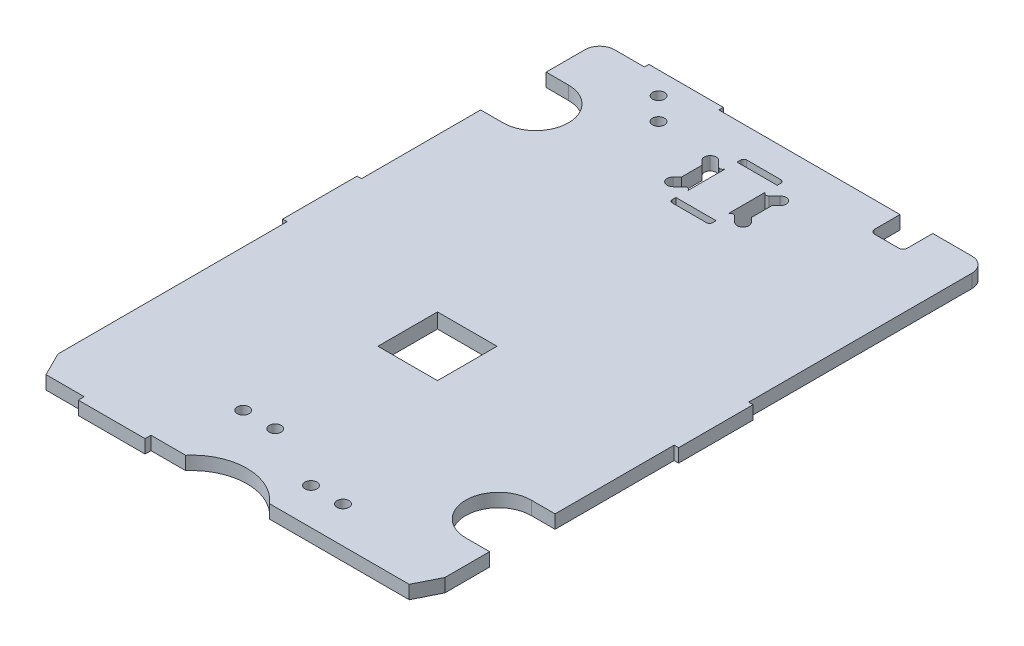
from build123d import *

# Parameters (mm, degrees)
CROQUIS1_R               = 0.4
SALIENTE_EXTRUIR1_DEPTH  = 0.9
SALIENTE_EXTRUIR2_DEPTH  = 0.1
CROQUIS9_W               = 4
CROQUIS9_H               = 4
CORTAR_EXTRUIR1_DEPTH    = 24.083103769
CROQUIS11_W              = 1.7
CROQUIS11_H              = 2.1
CROQUIS11_W_2            = 4.63
CROQUIS11_H_2            = 3.2
CROQUIS11_W_3            = 0.8
CROQUIS11_H_3            = 1.6
CROQUIS11_W_4            = 3
CROQUIS11_H_4            = 2.7
CROQUIS11_W_5            = 0.5
CROQUIS11_H_5            = 1
CROQUIS11_W_6            = 1
CROQUIS11_H_6            = 0.5
CROQUIS11_W_7            = 2.1
CROQUIS11_H_7            = 1.2
CROQUIS11_W_8            = 2.7
CROQUIS11_H_8            = 4.11
CROQUIS11_W_9            = 1.608844284
SALIENTE_EXTRUIR3_DEPTH  = 0.5
CROQUIS12_R              = 1.6
SALIENTE_EXTRUIR5_DEPTH  = 1.5
CROQUIS13_W              = 3.618464466
CROQUIS13_H              = 3.2
SALIENTE_EXTRUIR6_DEPTH  = 0.5
CROQUIS15_W              = 3
CROQUIS15_H              = 2.7
SALIENTE_EXTRUIR7_DEPTH  = 0.4
CROQUIS16_W              = 2.7
CROQUIS16_H              = 4.11
SALIENTE_EXTRUIR8_DEPTH  = 2
REDONDEO1_R              = 1.5
CORTAR_EXTRUIR3_DEPTH    = 4.11
CROQUIS21_W              = 2.7
CROQUIS21_H              = 4.11
SALIENTE_EXTRUIR10_DEPTH = 0.9
CROQUIS22_W              = 0.3
CROQUIS22_H              = 5
CROQUIS22_W_2            = 4.485919578
CROQUIS22_H_2            = 0.396504541
CROQUIS22_W_3            = 5
CROQUIS22_H_3            = 0.3
SALIENTE_EXTRUIR11_DEPTH = 0.9


with BuildPart() as part:
    # Croquis1 → Saliente-Extruir1 (new body)
    with BuildSketch(Plane(origin=(0, 0, 0), x_dir=(1, 0, 0), z_dir=(0, 1, 0))):
        with BuildLine():
            Line((-12.945636725, 11.010872655), (-11.445636725, 11.010872655))
            ThreePointArc((-11.445636725, 11.010872655), (-9.890001807, 11.655237736), (-9.245636725, 13.210872655))
            ThreePointArc((-9.245636725, 13.210872655), (-9.890001807, 14.766507574), (-11.445636725, 15.410872655))
            Line((-11.445636725, 15.410872655), (-12.945636725, 15.410872655))
            Line((-12.945636725, 15.410872655), (-12.945636725, 18.010872655))
            ThreePointArc((-12.945636725, 18.010872655), (-12.652743507, 18.717979436), (-11.945636725, 19.010872655))
            Line((-11.945636725, 19.010872655), (-9.945636725, 19.010872655))
            Line((-9.945636725, 19.010872655), (7.229363275, 19.010872655))
            Line((7.229363275, 19.010872655), (7.229363275, 17.310872655))
            ThreePointArc((7.229363275, 17.310872655), (7.31723124, 17.098740621), (7.529363275, 17.010872655))
            Line((7.529363275, 17.010872655), (9.129363275, 17.010872655))
            ThreePointArc((9.129363275, 17.010872655), (9.341495309, 17.098740621), (9.429363275, 17.310872655))
            Line((9.429363275, 17.310872655), (9.429363275, 19.010872655))
            Line((9.429363275, 19.010872655), (12.054363275, 19.010872655))
            ThreePointArc((12.054363275, 19.010872655), (12.761470056, 18.717979436), (13.054363275, 18.010872655))
            Line((13.054363275, 18.010872655), (13.054363275, -9.989127345))
            Line((13.054363275, -9.989127345), (11.454363275, -9.989127345))
            ThreePointArc((11.454363275, -9.989127345), (9.898728356, -10.633492426), (9.254363275, -12.189127345))
            ThreePointArc((9.254363275, -12.189127345), (9.898728356, -13.744762264), (11.454363275, -14.389127345))
            Line((11.454363275, -14.389127345), (13.054363275, -14.389127345))
            Line((13.054363275, -14.389127345), (13.054363275, -17.389127345))
            Line((13.054363275, -17.389127345), (12.254363275, -18.989127345))
            Line((12.254363275, -18.989127345), (2.870363275, -18.989127345))
            ThreePointArc((2.870363275, -18.989127345), (0.054363275, -17.689112497), (-2.761636725, -18.989127345))
            Line((-2.761636725, -18.989127345), (-12.145636725, -18.989127345))
            Line((-12.145636725, -18.989127345), (-12.945636725, -17.389127345))
            Line((-12.945636725, -17.389127345), (-12.945636725, 11.010872655))
        make_face()
        with Locations(Location((-6.295636725, 16.310872655, 0), (0, 0, 270))):
            Circle(CROQUIS1_R, mode=Mode.SUBTRACT)
        with Locations(Location((-7.795636725, 17.810872655, 0), (0, 0, 270))):
            Circle(CROQUIS1_R, mode=Mode.SUBTRACT)
        with Locations(Location((5.354363275, -16.539127345, 0), (0, 0, 270))):
            Circle(CROQUIS1_R, mode=Mode.SUBTRACT)
        with Locations(Location((3.204363275, -16.539127345, 0), (0, 0, 270))):
            Circle(CROQUIS1_R, mode=Mode.SUBTRACT)
        with Locations(Location((-1.295636725, -14.439127345, 0), (0, 0, 270))):
            Circle(CROQUIS1_R, mode=Mode.SUBTRACT)
        with Locations(Location((-3.445636725, -14.439127345, 0), (0, 0, 270))):
            Circle(CROQUIS1_R, mode=Mode.SUBTRACT)
        with BuildLine():
            Line((1.404363275, 15.833198756), (1.404363275, 16.835872655))
            ThreePointArc((1.404363275, 16.835872655), (1.345395371, 16.977683453), (1.203263275, 17.035872655))
            Line((1.203263275, 17.035872655), (-1.096736725, 17.035872655))
            ThreePointArc((-1.096736725, 17.035872655), (-1.237769709, 16.977226932), (-1.295636725, 16.835872655))
            Line((-1.295636725, 16.835872655), (-1.295636725, 15.834372655))
            ThreePointArc((-1.295636725, 15.834372655), (-1.418573103, 15.649826455), (-1.636236725, 15.692172655))
            Line((-1.636236725, 15.692172655), (-2.012836725, 16.068672655))
            ThreePointArc((-2.012836725, 16.068672655), (-2.296536432, 16.186162562), (-2.580235725, 16.068671655))
            ThreePointArc((-2.580235725, 16.068671655), (-2.697025443, 15.784219946), (-2.576636725, 15.501272655))
            Line((-2.576636725, 15.501272655), (-2.295636725, 15.220172655))
            Line((-2.295636725, 15.220172655), (-2.295636725, 13.851572655))
            Line((-2.295636725, 13.851572655), (-2.580236725, 13.566872655))
            ThreePointArc((-2.580236725, 13.566872655), (-2.696232572, 13.284222944), (-2.57664807, 13.003072731))
            ThreePointArc((-2.57664807, 13.003072731), (-2.294742413, 12.888371406), (-2.012836725, 13.003072655))
            Line((-2.012836725, 13.003072655), (-1.637936725, 13.377872655))
            ThreePointArc((-1.637936725, 13.377872655), (-1.419510166, 13.421357727), (-1.295636725, 13.236272655))
            Line((-1.295636725, 13.236272655), (-1.295636725, 12.235872655))
            ThreePointArc((-1.295636725, 12.235872655), (-1.236668822, 12.094061857), (-1.094536725, 12.035872655))
            Line((-1.094536725, 12.035872655), (1.205463275, 12.035872655))
            ThreePointArc((1.205463275, 12.035872655), (1.346496258, 12.094518378), (1.404363275, 12.235872655))
            Line((1.404363275, 12.235872655), (1.404363275, 13.238472655))
            ThreePointArc((1.404363275, 13.238472655), (1.528640054, 13.423270957), (1.746663275, 13.377872655))
            Line((1.746663275, 13.377872655), (2.121563219, 13.003072259))
            ThreePointArc((2.121563219, 13.003072259), (2.403468787, 12.886325049), (2.685374393, 13.003072166))
            ThreePointArc((2.685374393, 13.003072166), (2.802907805, 13.284235365), (2.688963388, 13.566872087))
            Line((2.688963388, 13.566872087), (2.40436356, 13.851572259))
            Line((2.40436356, 13.851572259), (2.40436356, 15.220172259))
            Line((2.40436356, 15.220172259), (2.68546356, 15.501272259))
            ThreePointArc((2.68546356, 15.501272259), (2.803432142, 15.784060173), (2.688313938, 16.068020363))
            ThreePointArc((2.688313938, 16.068020363), (2.405089942, 16.187185005), (2.121613288, 16.068622655))
            Line((2.121613288, 16.068622655), (1.746563288, 15.693772655))
            ThreePointArc((1.746563288, 15.693772655), (1.644399327, 15.638811711), (1.528855153, 15.649190726))
            ThreePointArc((1.528855153, 15.649190726), (1.438410002, 15.722116374), (1.404363275, 15.833198756))
        make_face(mode=Mode.SUBTRACT)
    extrude(amount=SALIENTE_EXTRUIR1_DEPTH)

    # Croquis8 → Saliente-Extruir2 (add)
    with BuildSketch(Plane.XZ):
        with BuildLine():
            Line((-4.445636725, 7.989127345), (2.554363275, 7.989127345))
            ThreePointArc((2.554363275, 7.989127345), (2.907916665, 7.842680736), (3.054363275, 7.489127345))
            Line((3.054363275, 7.489127345), (3.054363275, 0.489127345))
            ThreePointArc((3.054363275, 0.489127345), (2.907916665, 0.135573954), (2.554363275, -0.010872655))
            Line((2.554363275, -0.010872655), (-4.445636725, -0.010872655))
            ThreePointArc((-4.445636725, -0.010872655), (-4.799190116, 0.135573954), (-4.945636725, 0.489127345))
            Line((-4.945636725, 0.489127345), (-4.945636725, 7.489127345))
            ThreePointArc((-4.945636725, 7.489127345), (-4.799190116, 7.842680736), (-4.445636725, 7.989127345))
        make_face()
    extrude(amount=SALIENTE_EXTRUIR2_DEPTH)

    # Croquis9 → Cortar-Extruir1 (cut, through all)
    with BuildSketch(Plane.XZ.offset(0.1)):
        with Locations((-0.645636725, 4.189127345)):
            Rectangle(CROQUIS9_W, CROQUIS9_H)
    extrude(amount=-CORTAR_EXTRUIR1_DEPTH, mode=Mode.SUBTRACT)

    # Croquis11 → Saliente-Extruir3 (add)
    with BuildSketch(Plane.XZ):
        with Locations((-8.595636725, -8.206822709)):
            Rectangle(CROQUIS11_W, CROQUIS11_H)
        with Locations((-8.260636725, -3.770872655)):
            Rectangle(CROQUIS11_W_2, CROQUIS11_H_2)
        with Locations((8.654363275, -0.110872655)):
            Rectangle(CROQUIS11_W_3, CROQUIS11_H_3)
        with Locations((9.054363275, -5.660872655)):
            Rectangle(CROQUIS11_W_4, CROQUIS11_H_4)
        with Locations((9.804363275, -0.910872655)):
            Rectangle(CROQUIS11_W_5, CROQUIS11_H_5)
        with Locations((11.254363275, 6.739127345)):
            Rectangle(CROQUIS11_W_6, CROQUIS11_H_6)
        with Locations((11.254363275, 5.939127345)):
            Rectangle(CROQUIS11_W_6, CROQUIS11_H_6)
        with Locations((9.054363275, -2.560872655)):
            Rectangle(CROQUIS11_W_6, CROQUIS11_H_6)
        with Locations((11.404363275, -2.579902823)):
            Rectangle(CROQUIS11_W_5, CROQUIS11_H_5)
        with Locations((11.404363275, -6.057464759)):
            Rectangle(CROQUIS11_W_5, CROQUIS11_H_5)
        with Locations((8.254363275, -8.760872655)):
            Rectangle(CROQUIS11_W_6, CROQUIS11_H_6)
        with Locations((11.154363275, -8.760872655)):
            Rectangle(CROQUIS11_W_6, CROQUIS11_H_6)
        with Locations((-10.595636725, -8.220872655)):
            Rectangle(CROQUIS11_W, CROQUIS11_H)
        with Locations((-10.145636725, -6.220090356)):
            Rectangle(CROQUIS11_W_6, CROQUIS11_H_6)
        with Locations((-7.495636725, -16.910872655)):
            Rectangle(CROQUIS11_W_7, CROQUIS11_H_7)
        with Locations((0.054363275, -14.530872655)):
            Rectangle(CROQUIS11_W_8, CROQUIS11_H_8)
        with Locations((-6.641214583, -8.205114662)):
            Rectangle(CROQUIS11_W_9, CROQUIS11_H)
    extrude(amount=SALIENTE_EXTRUIR3_DEPTH)


with BuildPart() as saliente_extruir3_piece_1:
    # of the separate pieces the step leaves, piece 1, a body of its own (saliente_extruir3_pieces)
    add(part.part.solids().sort_by_distance((2.870363275, 0, 18.989127345))[0])

    # Croquis12 → Saliente-Extruir5 (add)
    with BuildSketch(Plane.XZ.offset(0.5)):
        with Locations(Location((-8.260636725, -3.770872655, 0), (0, 0, 270))):
            Circle(CROQUIS12_R)
    extrude(amount=SALIENTE_EXTRUIR5_DEPTH)

    # Croquis13 → Saliente-Extruir6 (add)
    with BuildSketch(Plane.XZ.offset(2)):
        with Locations((-8.251404492, -3.770872655)):
            Rectangle(CROQUIS13_W, CROQUIS13_H)
    extrude(amount=SALIENTE_EXTRUIR6_DEPTH)

    # Croquis15 → Saliente-Extruir7 (add)
    with BuildSketch(Plane.XZ.offset(0.5)):
        with Locations((9.054363275, -5.660872655)):
            Rectangle(CROQUIS15_W, CROQUIS15_H)
    extrude(amount=SALIENTE_EXTRUIR7_DEPTH)



with BuildPart() as saliente_extruir3_piece_2:
    # of the separate pieces the step leaves, piece 2, a body of its own (saliente_extruir3_pieces)
    add(part.part.solids().sort_by_distance((-1.295636725, -0.5, -16.585872655))[0])

    # Croquis16 → Saliente-Extruir8 (add)
    with BuildSketch(Plane.XZ.offset(0.5)):
        with Locations((0.054363275, -14.530872655)):
            Rectangle(CROQUIS16_W, CROQUIS16_H)
    extrude(amount=SALIENTE_EXTRUIR8_DEPTH)

    # Redondeo1
    # the kernel refuses this fillet: 1.5 mm, written as the material it takes off along each edge
    with BuildSketch(Plane(origin=(1.404363275, -2.5, -20.335872655), x_dir=(0, 1, 0), z_dir=(0, 0, 1)), Plane(origin=(-1.295636725, -2.5, -8.725872655), x_dir=(0, 1, 0), z_dir=(0, 0, -1))) as redondeo1_piece_1:
        with BuildLine():
            CenterArc((REDONDEO1_R, REDONDEO1_R), REDONDEO1_R, 180, 90)
            Line((0, REDONDEO1_R), (0, 0))
            Line((0, 0), (REDONDEO1_R, 0))
        make_face()
    extrude(amount=11.61, mode=Mode.SUBTRACT)

    # Croquis17 → Cortar-Extruir3 (cut)
    with BuildSketch(Plane(origin=(0, 0, -16.585872655), x_dir=(-1, 0, 0), z_dir=(0, 0, -1))):
        with BuildLine():
            ThreePointArc((-1.204363275, -1), (-0.875187667, -1.864580823), (-0.054363275, -2.291317157))
            ThreePointArc((-0.054363275, -2.291317157), (0.766461117, -1.864580823), (1.095636725, -1))
            Line((1.095636725, -1), (1.095636725, -0.2))
            Line((1.095636725, -0.2), (-1.204363275, -0.2))
            Line((-1.204363275, -0.2), (-1.204363275, -1))
        make_face()
    extrude(amount=-CORTAR_EXTRUIR3_DEPTH, mode=Mode.SUBTRACT)


with BuildPart() as saliente_extruir3_piece_1_1:
    add(saliente_extruir3_piece_1.part)

    add(saliente_extruir3_piece_2.part)  # Saliente-Extruir10 merges Saliente-Extruir3 piece 2
    # Croquis21 → Saliente-Extruir10 (add)
    with BuildSketch(Plane(origin=(0, 0, 0), x_dir=(1, 0, 0), z_dir=(0, 1, 0))):
        with Locations((0.054363275, 14.530872655)):
            Rectangle(CROQUIS21_W, CROQUIS21_H)
    extrude(amount=SALIENTE_EXTRUIR10_DEPTH)

    # Croquis22 → Saliente-Extruir11 (add)
    with BuildSketch(Plane(origin=(0, 0.9, 0), x_dir=(1, 0, 0), z_dir=(0, 1, 0))):
        with Locations((-13.095636725, 0.510872655)):
            Rectangle(CROQUIS22_W, CROQUIS22_H)
        with Locations((-7.337208758, -19.187379615)):
            Rectangle(CROQUIS22_W_2, CROQUIS22_H_2)
        with Locations((-7.445636725, 19.160872655)):
            Rectangle(CROQUIS22_W_3, CROQUIS22_H_3)
        with Locations((13.204363275, 0.510872655)):
            Rectangle(CROQUIS22_W, CROQUIS22_H)
    extrude(amount=-SALIENTE_EXTRUIR11_DEPTH)


solid = saliente_extruir3_piece_1_1.part
